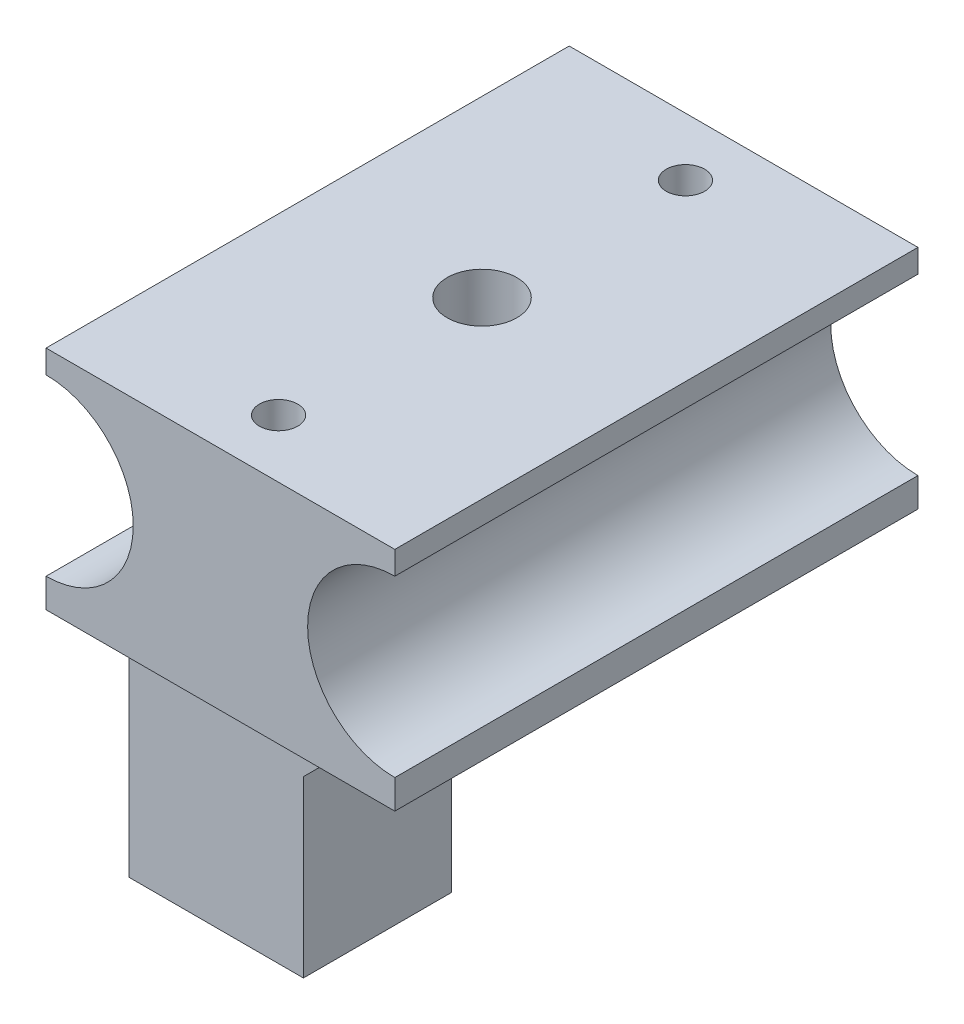
from build123d import *

# Parameters (mm, degrees)
BOSS_EXTRUDE1_DEPTH       = 22.5
M4X0_7_TAPPED_HOLE2_D     = 3.3
BOSS_EXTRUDE3_DEPTH       = 6.3625
M4X0_7_TAPPED_HOLE1_D     = 3.3
M4X0_7_TAPPED_HOLE1_DEPTH = 10
M4X0_7_TAPPED_HOLE1_TIP   = 0.991420021
CUT_EXTRUDE2_DEPTH        = 85
SKETCH2_R                 = 3
CUT_EXTRUDE1_DEPTH        = 50


with BuildPart() as part:
    # Sketch1 → Boss-Extrude1 (new, symmetric)
    with BuildSketch(Plane.XY):
        with BuildLine():
            Line((-15, 7.5), (-15, 9.5))
            Line((-15, 9.5), (15, 9.5))
            Line((15, 9.5), (15, 7.5))
            ThreePointArc((15, 7.5), (7.5, 0), (15, -7.5))
            Line((15, -7.5), (15, -10))
            Line((15, -10), (-15, -10))
            Line((-15, -10), (-15, -7.5))
            ThreePointArc((-15, -7.5), (-7.5, 0), (-15, 7.5))
        make_face()
    extrude(amount=BOSS_EXTRUDE1_DEPTH, both=True)

    # M4x0.7 Tapped Hole2 (through all)
    with Locations(Plane(origin=(0, -10, 0), x_dir=(-1, 0, 0), z_dir=(0, -1, 0))):
        with Locations((0, -17.5), (0, 17.5)):
            Hole(M4X0_7_TAPPED_HOLE2_D / 2)

    # Sketch7 → Boss-Extrude3 (add, symmetric)
    with BuildSketch(Plane.XY):
        Polygon((-15, -7.5), (-24, -7.5), (-24, -42.5), (-9, -42.5), (-9, -27.5), (8.5, -10), (-15, -10), align=None)
    extrude(amount=BOSS_EXTRUDE3_DEPTH, both=True)

    # M4x0.7 Tapped Hole1
    with Locations(Plane(origin=(-24, 0, 0), x_dir=(0, 0, -1), z_dir=(-1, 0, 0))):
        with Locations((0, 37.5), (0, 22.5)):
            Hole(M4X0_7_TAPPED_HOLE1_D / 2, depth=M4X0_7_TAPPED_HOLE1_DEPTH)
            with Locations((0, 0, -(M4X0_7_TAPPED_HOLE1_DEPTH + M4X0_7_TAPPED_HOLE1_TIP / 2))):  # 118° drill point
                Cone(0, M4X0_7_TAPPED_HOLE1_D / 2, M4X0_7_TAPPED_HOLE1_TIP, mode=Mode.SUBTRACT)

    # Sketch10 → Cut-Extrude2 (cut)
    with BuildSketch(Plane(origin=(0, 0, -6.3625), x_dir=(-1, 0, 0), z_dir=(0, 0, -1))):
        Polygon((15, -10), (24, -19), (24, -7.5), (15, -7.5), align=None)
    extrude(amount=-CUT_EXTRUDE2_DEPTH, mode=Mode.SUBTRACT)

    # Sketch2 → Cut-Extrude1 (cut)
    with BuildSketch(Plane(origin=(0, 9.5, 0), x_dir=(1, 0, 0), z_dir=(0, 1, 0))):
        Circle(SKETCH2_R)
    extrude(amount=-CUT_EXTRUDE1_DEPTH, mode=Mode.SUBTRACT)


solid = part.part
